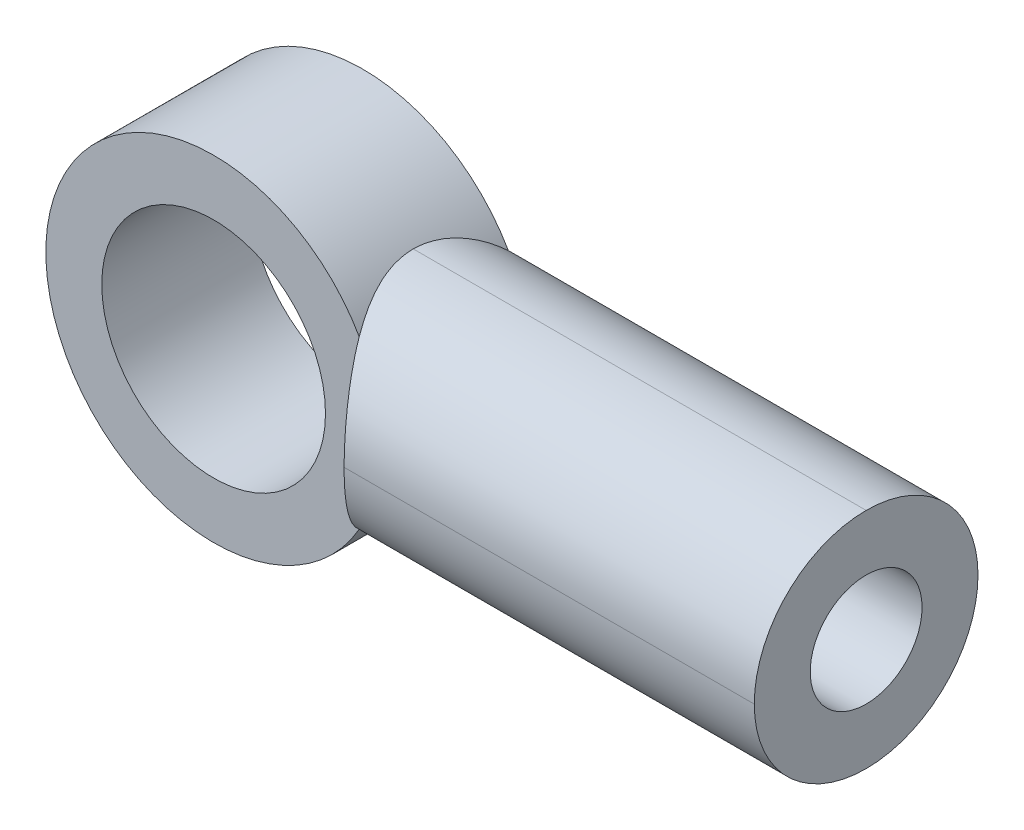
from build123d import *

# Parameters (mm, degrees)
BOSS_EXTRUDE1_DEPTH     = 3
CUT_EXTRUDE1_DEPTH      = 18.219175358
CUT_EXTRUDE1_DEPTH_BACK = 18.219175358
SKETCH10_R              = 3
SKETCH11_R              = 1.5
CUT_EXTRUDE2_DEPTH      = 10
FILLET1_R               = 3
CUT_EXTRUDE3_START      = -2
SKETCH12_R              = 4.5
CUT_EXTRUDE3_DEPTH      = 10


with BuildPart() as part:
    # Sketch1 → Boss-Extrude1 (new, symmetric)
    with BuildSketch(Plane.XY):
        with BuildLine():
            Line((3.354101966, -3), (15.5, -3))
            Line((15.5, -3), (15.5, 3))
            Line((15.5, 3), (3.354101966, 3))
            ThreePointArc((3.354101966, 3), (-4.5, 0), (3.354101966, -3))
        make_face()
    extrude(amount=BOSS_EXTRUDE1_DEPTH, both=True)

    # Sketch10 → Cut-Extrude1 (cut, two sides: drawn at the far end of the back side and taken through both)
    with BuildSketch(Plane.XY.offset(3).offset(-CUT_EXTRUDE1_DEPTH_BACK)):
        Circle(SKETCH10_R)
    extrude(amount=CUT_EXTRUDE1_DEPTH + CUT_EXTRUDE1_DEPTH_BACK, mode=Mode.SUBTRACT)

    # Sketch11 → Cut-Extrude2 (cut)
    with BuildSketch(Plane(origin=(15.5, 0, 0), x_dir=(0, 0, -1), z_dir=(1, 0, 0))):
        Circle(SKETCH11_R)
    extrude(amount=-CUT_EXTRUDE2_DEPTH, mode=Mode.SUBTRACT)

    # Fillet1
    fillet1_edges = [part.edges().sort_by_distance(p)[0] for p in [
        (9.427050983, -3, 3),
        (9.427050983, -3, -3),
        (9.427050983, 3, -3),
        (9.427050983, 3, 3),
    ]]
    fillet(fillet1_edges, radius=FILLET1_R - 0.0001)  # a hair under: the kernel refuses the full size

    # Sketch12 → Cut-Extrude3 (cut)
    with BuildSketch(Plane.XY.offset(CUT_EXTRUDE3_START)):
        Circle(SKETCH12_R)
    cut_extrude3 = extrude(amount=-CUT_EXTRUDE3_DEPTH, mode=Mode.SUBTRACT)

    # Mirror1: Cut-Extrude3 across plane
    add(cut_extrude3.mirror(Plane.XY), mode=Mode.SUBTRACT)


solid = part.part
